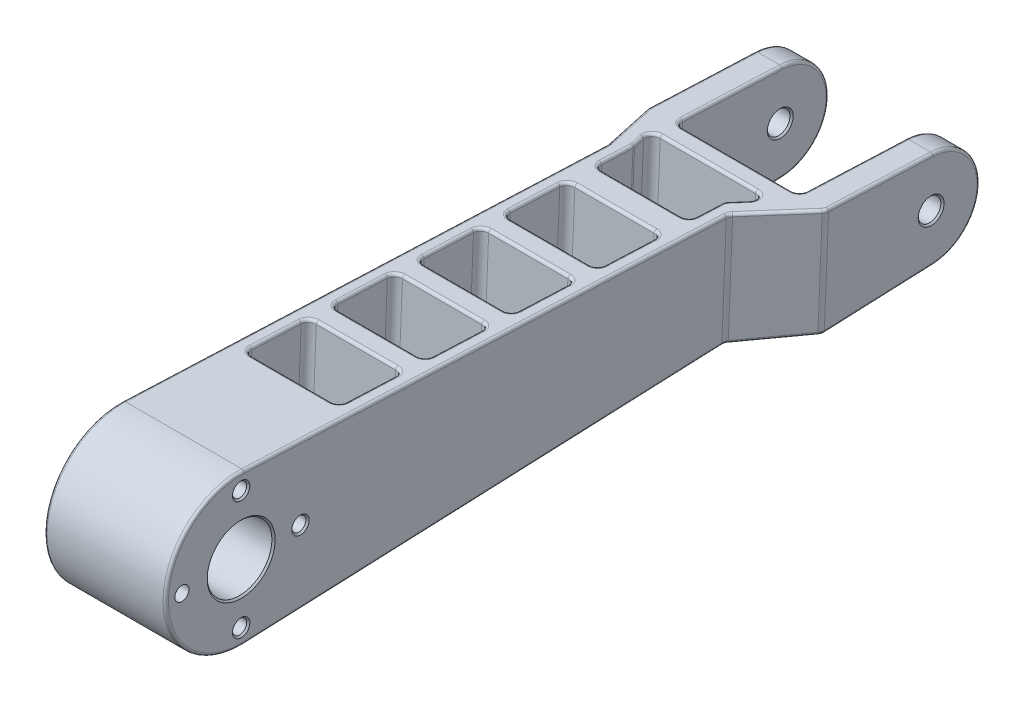
from build123d import *

# Parameters (mm, degrees)
EXTRUDE_1_DEPTH      = 33
SKETCH_2_OUTSIDE_W   = 174.882
SKETCH_2_OUTSIDE_H   = 59.882
SKETCH_2_OUTSIDE_R   = 6
SKETCH_2_OUTSIDE_R_2 = 1.310775321
SKETCH_2_OUTSIDE_R_3 = 2.1
CUT_EXTRUDE_1_DEPTH  = 134.888012906
SKETCH_5_W           = 17.5
SKETCH_5_H           = 12
SKETCH_5_W_2         = 23
SKETCH_5_H_2         = 46.176579124
CUT_EXTRUDE_3_DEPTH  = 136.510736012
CHAMFER_2_SIZE       = 0.3
FILLET_4_R           = 1.4
FILLET_5_R           = 0.5


with BuildPart() as part:
    # 草图1 → 凸台-拉伸1 (new body)
    with BuildSketch(Plane(origin=(0, 0, 0), x_dir=(0, 0, -1), z_dir=(1, 0, 0))):
        with BuildLine():
            Line((120.375, 8.992184106), (0.583333333, 13.987841943))
            ThreePointArc((0.583333333, 13.987841943), (-14, 0), (0.583333333, -13.987841943))
            Line((0.583333333, -13.987841943), (120.375, -8.992184106))
            ThreePointArc((120.375, -8.992184106), (129, 0), (120.375, 8.992184106))
        make_face()
    extrude(amount=EXTRUDE_1_DEPTH)

    # 草图2 outside → 切除-拉伸1 (cut, through all)
    # profile 1 of 7: a face of its own
    with BuildSketch(Plane.ZY):
        with Locations((-57.5, 0)):
            Rectangle(SKETCH_2_OUTSIDE_W, SKETCH_2_OUTSIDE_H)
        with BuildLine():
            Line((-120.375, -8.992184106), (-0.583333333, -13.987841943))
            ThreePointArc((-0.583333333, -13.987841943), (14, 0), (-0.583333333, 13.987841943))
            Line((-0.583333333, 13.987841943), (-120.375, 8.992184106))
            ThreePointArc((-120.375, 8.992184106), (-129, 0), (-120.375, -8.992184106))
        make_face(mode=Mode.SUBTRACT)
    # profile 2 of 7: a face of its own
    with BuildSketch(Plane.ZY):
        Circle(SKETCH_2_OUTSIDE_R)
    # profile 3 of 7: a face of its own
    with BuildSketch(Plane.ZY):
        with Locations((11, 0)):
            Circle(SKETCH_2_OUTSIDE_R_2)
    # profile 4 of 7: a face of its own
    with BuildSketch(Plane.ZY):
        with Locations((0, -11)):
            Circle(SKETCH_2_OUTSIDE_R_2)
    # profile 5 of 7: a face of its own
    with BuildSketch(Plane.ZY):
        with Locations((-11, 0)):
            Circle(SKETCH_2_OUTSIDE_R_2)
    # profile 6 of 7: a face of its own
    with BuildSketch(Plane.ZY):
        with Locations((0, 11)):
            Circle(SKETCH_2_OUTSIDE_R_2)
    # profile 7 of 7: a face of its own
    with BuildSketch(Plane.ZY):
        with Locations((-120, 0)):
            Circle(SKETCH_2_OUTSIDE_R_3)
    extrude(amount=-CUT_EXTRUDE_1_DEPTH, mode=Mode.SUBTRACT)

    # 草图5 → 切除-拉伸3 (cut, through all)
    with BuildSketch(Plane(origin=(0, 13.987841943, -0.583333333), x_dir=(1, 0, 0), z_dir=(0, 0.9991315673568165, -0.041666666666666685))):
        with Locations((13.75, 42)):
            Rectangle(SKETCH_5_W, SKETCH_5_H)
        Polygon((2.5, 90), (0, 100), (0, -28.362184553), (2.5, -28.362184553), align=None)
        with Locations((16.5, 123.088289562)):
            Rectangle(SKETCH_5_W_2, SKETCH_5_H_2)
        Polygon((33, 100), (25, 90), (25, -28.362184553), (33, -28.362184553), align=None)
        with Locations((13.75, 26)):
            Rectangle(SKETCH_5_W, SKETCH_5_H)
        with Locations((13.75, 58)):
            Rectangle(SKETCH_5_W, SKETCH_5_H)
        with Locations((13.75, 74)):
            Rectangle(SKETCH_5_W, SKETCH_5_H)
        Polygon((3.967329219, 96.5), (5, 92.369316877), (5, 85), (22.5, 85), (22.5, 91.677343178), (26.358125458, 96.5), align=None)
    extrude(amount=-CUT_EXTRUDE_3_DEPTH, mode=Mode.SUBTRACT)

    # 倒角2
    chamfer_2_edges = [part.edges().sort_by_distance(p)[0] for p in [
        (25, -11, -1.310775321),
        (2.5, -11, -1.310775321),
        (25, 11, -1.310775321),
        (2.5, 11, -1.310775321),
        (25, 0, -12.310775321),
        (2.5, 0, -12.310775321),
        (25, 0, -6),
        (2.5, 0, -6),
        (33, 0, -122.1),
        (28, 0, -122.1),
        (5, 0, -122.1),
        (0, 0, -122.1),
        (2.5, 0, 9.689224679),
    ]]
    chamfer(chamfer_2_edges, length=CHAMFER_2_SIZE)

    # 圆角4
    fillet_4_edges = [part.edges().sort_by_distance(p)[0] for p in [
        (5, -0.022917262, -20.016428034),
        (5, -0.021755822, -36.030383469),
        (5, -0.020594382, -52.044338904),
        (5, -0.022046182, -32.02689461),
        (5, -0.020884742, -48.040850045),
        (5, -0.019723302, -64.05480548),
        (22.5, -0.022046182, -32.02689461),
        (22.5, -0.020884742, -48.040850045),
        (22.5, -0.022917262, -20.016428034),
        (22.5, -0.021755822, -36.030383469),
        (22.5, -0.020594382, -52.044338904),
        (22.5, -0.019723302, -64.05480548),
        (5, -0.019432942, -68.058294339),
        (22.5, -0.019432942, -68.058294339),
        (5, -0.017110061, -100.086205209),
        (28, -0.017110061, -100.086205209),
        (33, -0.017110061, -100.086205209),
        (25, -0.017835962, -90.077483062),
        (0, -0.017110061, -100.086205209),
        (2.5, -0.017835962, -90.077483062),
        (26.358125458, -0.017364126, -96.583152457),
        (3.967329219, -0.017364126, -96.583152457),
        (5, -0.018198912, -85.073121988),
        (22.5, -0.018198912, -85.073121988),
        (22.5, -0.017714203, -91.756289243),
        (5, -0.017663973, -92.448866491),
        (22.5, -0.018561862, -80.068760915),
        (5, -0.018561862, -80.068760915),
    ]]
    fillet(fillet_4_edges, radius=FILLET_4_R)

    # 圆角5
    fillet_5_edges = [part.edges().sort_by_distance(p)[0] for p in [
        (2.5, 0, 14),
        (0, 0, -129),
        (5, 0, -129),
        (28, 0, -129),
        (25, 0, 14),
        (33, 0, -129),
        (5.409190058, -12.715781951, -31.086260372),
        (13.75, -12.698600974, -31.498245731),
        (22.090809942, -12.715781951, -31.086260372),
        (22.5, -12.949472054, -25.482568559),
        (22.090809942, -13.183162157, -19.878876745),
        (13.75, -13.200343134, -19.466891387),
        (5.409190058, -13.183162157, -19.878876745),
        (5, -12.949472054, -25.482568559),
        (28, -9.39452146, -110.727289177),
        (27.590809942, -9.838214422, -100.087905707),
        (16.5, -9.855395399, -99.675920348),
        (5.409190058, -9.838214422, -100.087905707),
        (5, -9.39452146, -110.727289177),
        (0, -9.420186661, -110.111859273),
        (0.010488347, -9.855341043, -99.677223772),
        (1.25, -10.064454633, -94.662856038),
        (2.489511653, -10.273568223, -89.648488304),
        (2.5, -12.134280996, -45.030163432),
        (25, -12.140944667, -44.870374209),
        (25.078865342, -10.274677934, -89.621878364),
        (29, -10.064454633, -94.662856038),
        (32.921134658, -9.854231332, -99.703833712),
        (33, -9.41352299, -110.271648495),
        (5.409190058, -12.51417261, -35.920682538),
        (5, -12.280482507, -41.524374351),
        (5.409190058, -12.046792404, -47.128066164),
        (13.75, -12.029611427, -47.540051523),
        (22.090809942, -12.046792404, -47.128066164),
        (22.5, -12.280482507, -41.524374351),
        (22.090809942, -12.51417261, -35.920682538),
        (13.75, -12.531353587, -35.508697179),
        (5.409190058, -11.845183063, -51.96248833),
        (5, -11.61149296, -57.566180143),
        (5.409190058, -11.377802857, -63.169871957),
        (13.75, -11.36062188, -63.581857315),
        (22.090809942, -11.377802857, -63.169871957),
        (22.5, -11.61149296, -57.566180143),
        (22.090809942, -11.845183063, -51.96248833),
        (13.75, -11.86236404, -51.550502971),
        (5.409190058, -11.176193516, -68.004294122),
        (5, -10.942503413, -73.607985936),
        (22.5, -10.942503413, -73.607985936),
        (22.090809942, -11.176193516, -68.004294122),
        (13.75, -11.193374493, -67.592308763),
        (22.089949494, 12.671594047, -32.145849084),
        (13.75, 12.65450861, -32.555543489),
        (5.410050506, 12.671594047, -32.145849084),
        (5, 12.90450861, -26.560754085),
        (5.410050506, 13.137423172, -20.975659086),
        (13.75, 13.15450861, -20.56596468),
        (22.089949494, 13.137423172, -20.975659086),
        (22.5, 12.90450861, -26.560754085),
        (25.078920353, 10.238995433, -90.477514672),
        (25, 12.123073057, -45.298920364),
        (2.5, 12.116432524, -45.458154763),
        (2.489510579, 10.237895747, -90.50388421),
        (1.25, 10.02950861, -95.500832232),
        (0.010489421, 9.821121472, -100.497780254),
        (0, 9.403089111, -110.521844136),
        (5, 9.377513025, -111.135137132),
        (5.410050506, 9.804089839, -100.906184474),
        (16.5, 9.821175276, -100.496490069),
        (27.589949494, 9.804089839, -100.906184474),
        (28, 9.377513025, -111.135137132),
        (33, 9.396448577, -110.681078535),
        (32.921079647, 9.820021786, -100.524149793),
        (29, 10.02950861, -95.500832232),
        (22.089949494, 12.004927381, -48.131954161),
        (13.75, 11.987841943, -48.541648566),
        (5.410050506, 12.004927381, -48.131954161),
        (5, 12.237841943, -42.546859162),
        (5.410050506, 12.470756505, -36.961764163),
        (13.75, 12.487841943, -36.552069758),
        (22.089949494, 12.470756505, -36.961764163),
        (22.5, 12.237841943, -42.546859162),
        (22.089949494, 11.338260714, -64.118059239),
        (13.75, 11.321175276, -64.527753644),
        (5.410050506, 11.338260714, -64.118059239),
        (5, 11.571175276, -58.53296424),
        (5.410050506, 11.804089839, -52.947869241),
        (13.75, 11.821175276, -52.538174836),
        (22.089949494, 11.804089839, -52.947869241),
        (22.5, 11.571175276, -58.53296424),
        (5, 10.90450861, -74.519069318),
        (5.410050506, 11.137423172, -68.933974319),
        (13.75, 11.15450861, -68.524279914),
        (22.089949494, 11.137423172, -68.933974319),
        (22.5, 10.90450861, -74.519069318),
        (4.680208094, -10.120963992, -93.307809215),
        (4.656026599, -10.024297673, -95.6257861),
        (14.60283343, -10.001736863, -96.166775331),
        (24.70774262, -10.034974203, -95.369771913),
        (23.672625336, -10.142094012, -92.801129127),
        (24.707075202, 10.0000726, -96.206682938),
        (14.60283343, 9.96700861, -96.999529583),
        (4.656928575, 9.989442897, -96.46157426),
        (4.680208094, 10.085821755, -94.150490433),
        (23.672625336, 10.106878408, -93.645569651),
        (13.75, -10.691632333, -79.623663108),
        (22.090809942, -10.465392122, -85.048712776),
        (13.75, -10.4825731, -84.636727418),
        (5.409190058, -10.465392122, -85.048712776),
        (5, -10.302845525, -88.946443265),
        (4.989511653, -10.174502709, -92.023995879),
        (22.578865342, -10.204545118, -91.303604209),
        (22.5, -10.323975545, -88.439763177),
        (13.75, 10.65450861, -80.513858722),
        (4.989510579, 10.139174211, -92.871143495),
        (5, 10.267071755, -89.804268115),
        (5.410050506, 10.429089839, -85.919210964),
        (13.75, 10.446175276, -85.509516559),
        (22.089949494, 10.429089839, -85.919210964),
        (22.5, 10.288128408, -89.299347333),
        (22.578920353, 10.169106134, -92.15340119),
        (22.090809942, -10.70881331, -79.211677749),
        (5.409190058, -10.70881331, -79.211677749),
        (22.089949494, 10.671594047, -80.104164317),
        (5.410050506, 10.671594047, -80.104164317),
    ]]
    fillet(fillet_5_edges, radius=FILLET_5_R)


solid = part.part
